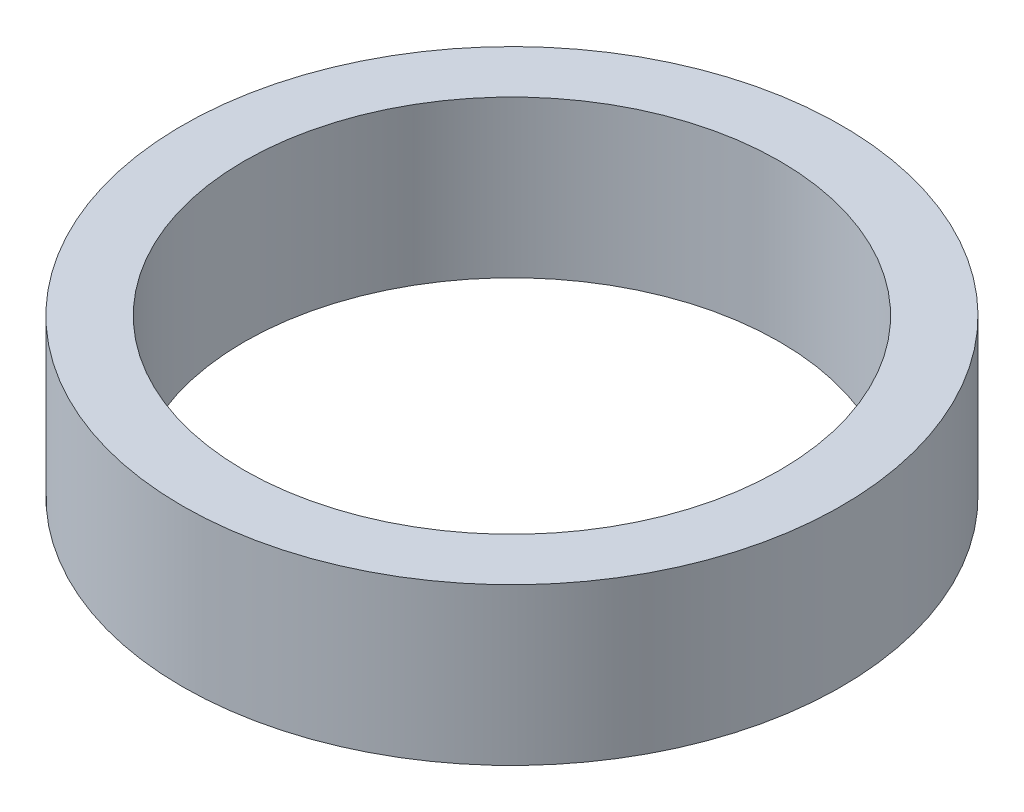
from build123d import *

# Parameters (mm, degrees)
SKETCH1_R           = 40
BOSS_EXTRUDE1_DEPTH = 19
SKETCH2_R           = 32.5
CUT_EXTRUDE1_DEPTH  = 60.674114991


with BuildPart() as part:
    # Sketch1 → Boss-Extrude1 (new body)
    with BuildSketch(Plane(origin=(0, 0, 0), x_dir=(1, 0, 0), z_dir=(0, 1, 0))):
        Circle(SKETCH1_R)
    extrude(amount=BOSS_EXTRUDE1_DEPTH)

    # Sketch2 → Cut-Extrude1 (cut, through all)
    with BuildSketch(Plane(origin=(0, 0, 0), x_dir=(1, 0, 0), z_dir=(0, 1, 0))):
        Circle(SKETCH2_R)
    extrude(amount=CUT_EXTRUDE1_DEPTH, mode=Mode.SUBTRACT)


solid = part.part
